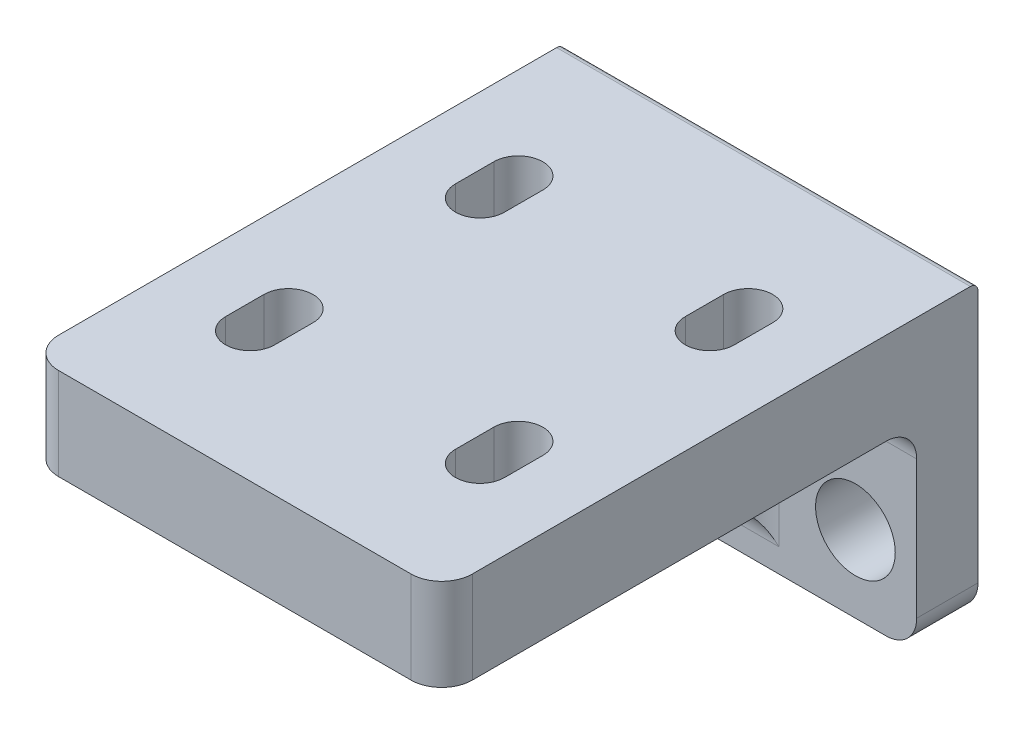
from build123d import *

# Parameters (mm, degrees)
EXTRUDE_2_DEPTH      = 3
EXTRUDE_2_DEPTH_BACK = 1
SKETCH_1_W           = 27
SKETCH_1_H           = 16
EXTRUDE_4_DEPTH      = 3
EXTRUDE_4_DEPTH_BACK = 3
SKETCH_3_W           = 27
SKETCH_3_H           = 34
CUT_EXTRUDE_11_DEPTH = 13
EXTRUDE_5_DEPTH      = 2.5
EXTRUDE_5_DEPTH_BACK = 2.5
FILLET_2_R           = 2
FILLET_3_R           = 2
SKETCH_14_W          = 27
SKETCH_14_H          = 3
EXTRUDE_6_DEPTH      = 1
FILLET_5_R           = 0.5
SKETCH_16_R          = 2.6
CUT_EXTRUDE_12_DEPTH = 4


with BuildPart() as part:
    # 草图1 → 凸台-拉伸2 (new, two sides: drawn at the far end of the back side and taken through both)
    with BuildSketch(Plane.XY.offset(-EXTRUDE_2_DEPTH_BACK)):
        with Locations((13.5, -8)):
            Rectangle(SKETCH_1_W, SKETCH_1_H)
    extrude(amount=EXTRUDE_2_DEPTH + EXTRUDE_2_DEPTH_BACK)

    # 草图3 → 凸台-拉伸4 (add, two sides: drawn at the far end of the back side and taken through both)
    with BuildSketch(Plane(origin=(0, 0, 0), x_dir=(1, 0, 0), z_dir=(0, 1, 0)).offset(-EXTRUDE_4_DEPTH_BACK)):
        with Locations((13.5, -17)):
            Rectangle(SKETCH_3_W, SKETCH_3_H)
    extrude(amount=EXTRUDE_4_DEPTH + EXTRUDE_4_DEPTH_BACK)

    # 草图4 → 切除-拉伸11 (cut)
    with BuildSketch(Plane(origin=(0, -3, 0), x_dir=(-1, 0, 0), z_dir=(0, -1, 0))):
        with BuildLine():
            Line((-7.6, -10.5), (-7.6, -8))
            ThreePointArc((-7.6, -8), (-6, -6.4), (-4.4, -8))
            Line((-4.4, -8), (-4.4, -10.5))
            ThreePointArc((-4.4, -10.5), (-6, -12.1), (-7.6, -10.5))
        make_face()
        with BuildLine():
            Line((-22.6, -10.5), (-22.6, -8))
            ThreePointArc((-22.6, -8), (-21, -6.4), (-19.4, -8))
            Line((-19.4, -8), (-19.4, -10.5))
            ThreePointArc((-19.4, -10.5), (-21, -12.1), (-22.6, -10.5))
        make_face()
        with BuildLine():
            Line((-7.6, -25.5), (-7.6, -23))
            ThreePointArc((-7.6, -23), (-6, -21.4), (-4.4, -23))
            Line((-4.4, -23), (-4.4, -25.5))
            ThreePointArc((-4.4, -25.5), (-6, -27.1), (-7.6, -25.5))
        make_face()
        with BuildLine():
            Line((-22.6, -25.5), (-22.6, -23))
            ThreePointArc((-22.6, -23), (-21, -21.4), (-19.4, -23))
            Line((-19.4, -23), (-19.4, -25.5))
            ThreePointArc((-19.4, -25.5), (-21, -27.1), (-22.6, -25.5))
        make_face()
    extrude(amount=-CUT_EXTRUDE_11_DEPTH, mode=Mode.SUBTRACT)

    # 草图13 → 凸台-拉伸5 (add, two sides: drawn at the far end of the back side and taken through both)
    with BuildSketch(Plane.ZY.offset(-13.5).offset(-EXTRUDE_5_DEPTH_BACK)):
        Polygon((3, -13), (34, -3), (3, -3), align=None)
    extrude(amount=EXTRUDE_5_DEPTH + EXTRUDE_5_DEPTH_BACK)

    # 圆角2
    fillet_2_edges = [part.edges().sort_by_distance(p)[0] for p in [
        (21.5, -3, 3),
        (5.5, -3, 3),
        (0, 0, 34),
        (27, 0, 34),
        (0, -16, 1),
        (27, -16, 1),
    ]]
    fillet(fillet_2_edges, radius=FILLET_2_R)

    # 圆角3
    # the kernel refuses this fillet: 2 mm, written as the material it adds along each edge
    with BuildSketch(Plane(origin=(11, -13, 3), x_dir=(0, -1, 0), z_dir=(1, 0, 0))) as fillet_3_piece_1:
        with BuildLine():
            CenterArc((FILLET_3_R * 0.728161127413, -FILLET_3_R), FILLET_3_R, 90, 72.121303404)
            Line((-FILLET_3_R * 0.223547490347, -FILLET_3_R * 0.692997220077), (0, 0))
            Line((0, 0), (FILLET_3_R * 0.728161127413, 0))
        make_face()
    extrude(amount=5)
    with BuildSketch(Plane(origin=(16, -3, 34), x_dir=(0, -1, 0), z_dir=(0, 0, -1))) as fillet_3_piece_2_section:
        with BuildLine():
            CenterArc((FILLET_3_R, -FILLET_3_R), FILLET_3_R, 90, 90)
            Line((0, -FILLET_3_R), (0, 0))
            Line((0, 0), (FILLET_3_R, 0))
        make_face()
    fillet_3_piece_2 = extrude(amount=29, mode=Mode.PRIVATE)
    fillet_3_piece_2 = split(fillet_3_piece_2, bisect_by=Plane(origin=(16.465034927, -7.473683047, 20.131582554), z_dir=(0, 0.9517086177605509, -0.3070027799227584)), keep=Keep.TOP, mode=Mode.PRIVATE)
    add(fillet_3_piece_2)
    with BuildSketch(Plane(origin=(11, -3, 34), x_dir=(-1, 0, 0), z_dir=(0, 0, -1))) as fillet_3_piece_3_section:
        with BuildLine():
            CenterArc((FILLET_3_R, -FILLET_3_R), FILLET_3_R, 90, 90)
            Line((0, -FILLET_3_R), (0, 0))
            Line((0, 0), (FILLET_3_R, 0))
        make_face()
    fillet_3_piece_3 = extrude(amount=29, mode=Mode.PRIVATE)
    fillet_3_piece_3 = split(fillet_3_piece_3, bisect_by=Plane(origin=(10.534965073, -7.473683047, 20.131582554), z_dir=(0, 0.9517086177605509, -0.3070027799227584)), keep=Keep.TOP, mode=Mode.PRIVATE)
    add(fillet_3_piece_3)
    with BuildSketch(Plane(origin=(11, -5, 3), x_dir=(-1, 0, 0), z_dir=(0, -1, 0))) as fillet_3_piece_4_section:
        with BuildLine():
            CenterArc((FILLET_3_R, -FILLET_3_R), FILLET_3_R, 90, 90)
            Line((0, -FILLET_3_R), (0, 0))
            Line((0, 0), (FILLET_3_R, 0))
        make_face()
    fillet_3_piece_4 = extrude(amount=13, mode=Mode.PRIVATE)
    fillet_3_piece_4 = split(fillet_3_piece_4, bisect_by=Plane(origin=(10.542698912, -12.486166037, 4.592885286), z_dir=(0, 0.9517086177605509, -0.3070027799227584)), keep=Keep.TOP, mode=Mode.PRIVATE)
    add(fillet_3_piece_4)
    with BuildSketch(Plane(origin=(11, -5, 5), x_dir=(0, 0, -1), z_dir=(0, -1, 0))) as fillet_3_piece_5:
        with BuildLine():
            CenterArc((2 - FILLET_3_R, -FILLET_3_R), FILLET_3_R, 0, 90)
            Line((2 - FILLET_3_R, 0), (2, 0))
            Line((2, 0), (2, -FILLET_3_R))
        make_face()
    revolve(axis=Axis((11, -5, 5), (1, 0, 0)), revolution_arc=90)
    with BuildSketch(Plane(origin=(16, -5, 3), x_dir=(1, 0, 0), z_dir=(0, -1, 0))) as fillet_3_piece_6_section:
        with BuildLine():
            CenterArc((FILLET_3_R, FILLET_3_R), FILLET_3_R, 180, 90)
            Line((0, FILLET_3_R), (0, 0))
            Line((0, 0), (FILLET_3_R, 0))
        make_face()
    fillet_3_piece_6 = extrude(amount=13, mode=Mode.PRIVATE)
    fillet_3_piece_6 = split(fillet_3_piece_6, bisect_by=Plane(origin=(16.457301088, -12.486166037, 4.592885286), z_dir=(0, 0.9517086177605509, -0.3070027799227584)), keep=Keep.TOP, mode=Mode.PRIVATE)
    add(fillet_3_piece_6)
    with BuildSketch(Plane(origin=(16, -5, 5), x_dir=(0, 0, -1), z_dir=(0, -1, 0))) as fillet_3_piece_7:
        with BuildLine():
            CenterArc((2 - FILLET_3_R, FILLET_3_R), FILLET_3_R, 270, 90)
            Line((2 - FILLET_3_R, 0), (2, 0))
            Line((2, 0), (2, FILLET_3_R))
        make_face()
    revolve(axis=Axis((16, -5, 5), (1, 0, 0)), revolution_arc=90)
    with BuildSketch(Plane(origin=(11, -5, 3), x_dir=(-1, 0, 0), z_dir=(0, -1, 0))) as fillet_3_piece_8a_section:
        with BuildLine():
            CenterArc((FILLET_3_R, -FILLET_3_R), FILLET_3_R, 90, 90)
            Line((0, -FILLET_3_R), (0, 0))
            Line((0, 0), (FILLET_3_R, 0))
        make_face()
    fillet_3_piece_8a = extrude(amount=13, mode=Mode.PRIVATE)
    fillet_3_piece_8a = split(fillet_3_piece_8a, bisect_by=Plane(origin=(10.55847084, -16, 3.471852111), z_dir=(0, 1, 0)), keep=Keep.TOP, mode=Mode.PRIVATE)
    fillet_3_piece_8a = split(fillet_3_piece_8a, bisect_by=Plane(origin=(10.55847084, -12.996338669, 3.011350127), z_dir=(0, -0.9517086177605509, 0.3070027799227584)), keep=Keep.TOP, mode=Mode.PRIVATE)
    with BuildSketch(Plane(origin=(7.359194363, -13, 3), x_dir=(0, -1, 0), z_dir=(1, 0, 0))) as fillet_3_piece_8b_section:
        with BuildLine():
            CenterArc((FILLET_3_R * 0.728161127413, -FILLET_3_R), FILLET_3_R, 90, 72.121303404)
            Line((-FILLET_3_R * 0.223547490347, -FILLET_3_R * 0.692997220077), (0, 0))
            Line((0, 0), (FILLET_3_R * 0.728161127413, 0))
        make_face()
    fillet_3_piece_8b = extrude(amount=8.640805637, mode=Mode.PRIVATE)
    fillet_3_piece_8b = split(fillet_3_piece_8b, bisect_by=Plane(origin=(11, -13.221902521, 3.304743707), z_dir=(-1, 0, 0)), keep=Keep.TOP, mode=Mode.PRIVATE)
    fillet_3_piece_8 = fillet_3_piece_8a & fillet_3_piece_8b
    add(fillet_3_piece_8)
    with BuildSketch(Plane(origin=(16, -5, 3), x_dir=(1, 0, 0), z_dir=(0, -1, 0))) as fillet_3_piece_9a_section:
        with BuildLine():
            CenterArc((FILLET_3_R, FILLET_3_R), FILLET_3_R, 180, 90)
            Line((0, FILLET_3_R), (0, 0))
            Line((0, 0), (FILLET_3_R, 0))
        make_face()
    fillet_3_piece_9a = extrude(amount=13, mode=Mode.PRIVATE)
    fillet_3_piece_9a = split(fillet_3_piece_9a, bisect_by=Plane(origin=(16.44152916, -16, 3.471852111), z_dir=(0, 1, 0)), keep=Keep.TOP, mode=Mode.PRIVATE)
    fillet_3_piece_9a = split(fillet_3_piece_9a, bisect_by=Plane(origin=(16.44152916, -12.996338669, 3.011350127), z_dir=(0, -0.9517086177605509, 0.3070027799227584)), keep=Keep.TOP, mode=Mode.PRIVATE)
    with BuildSketch(Plane(origin=(11, -13, 3), x_dir=(0, -1, 0), z_dir=(1, 0, 0))) as fillet_3_piece_9b_section:
        with BuildLine():
            CenterArc((FILLET_3_R * 0.728161127413, -FILLET_3_R), FILLET_3_R, 90, 72.121303404)
            Line((-FILLET_3_R * 0.223547490347, -FILLET_3_R * 0.692997220077), (0, 0))
            Line((0, 0), (FILLET_3_R * 0.728161127413, 0))
        make_face()
    fillet_3_piece_9b = extrude(amount=8.640805637, mode=Mode.PRIVATE)
    fillet_3_piece_9b = split(fillet_3_piece_9b, bisect_by=Plane(origin=(16, -13.221902521, 3.304743707), z_dir=(1, 0, 0)), keep=Keep.TOP, mode=Mode.PRIVATE)
    fillet_3_piece_9 = fillet_3_piece_9a & fillet_3_piece_9b
    add(fillet_3_piece_9)

    # 草图14 → 凸台-拉伸6 (add)
    with BuildSketch(Plane(origin=(0, 0, 0), x_dir=(-1, 0, 0), z_dir=(0, 0, -1))):
        with Locations((-13.5, 1.5)):
            Rectangle(SKETCH_14_W, SKETCH_14_H)
    extrude(amount=EXTRUDE_6_DEPTH)

    # 圆角5
    fillet_5_edges = [part.edges().sort_by_distance(p)[0] for p in [
        (13.5, 3, -1),
    ]]
    fillet(fillet_5_edges, radius=FILLET_5_R)

    # 草图16 → 切除-拉伸12 (cut)
    with BuildSketch(Plane.XY.offset(3)):
        with Locations((4, -11)):
            Circle(SKETCH_16_R)
        with Locations((23, -11)):
            Circle(SKETCH_16_R)
    extrude(amount=-CUT_EXTRUDE_12_DEPTH, mode=Mode.SUBTRACT)


solid = part.part
